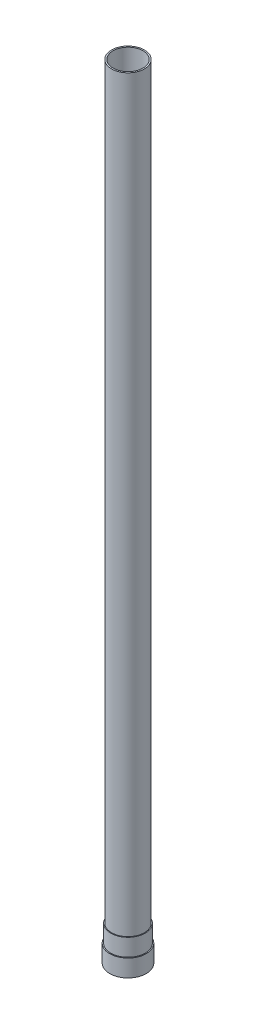
from build123d import *

# Parameters (mm, degrees)
SKETCH1_R           = 15
SKETCH1_R_2         = 13.462
BOSS_EXTRUDE1_DEPTH = 15
SKETCH4_R           = 14.2875
SKETCH4_R_2         = 13.0429
BOSS_EXTRUDE5_DEPTH = 650
BOSS_EXTRUDE6_START = -15
SKETCH1_4_R         = 15.875
SKETCH1_4_R_2       = 13.462
BOSS_EXTRUDE6_DEPTH = 15


with BuildPart() as part:
    # Sketch1 → Boss-Extrude1 (new body)
    with BuildSketch(Plane(origin=(0, 0, 0), x_dir=(1, 0, 0), z_dir=(0, 1, 0))):
        Circle(SKETCH1_R)
        Circle(SKETCH1_R_2, mode=Mode.SUBTRACT)
    extrude(amount=BOSS_EXTRUDE1_DEPTH)

    # Sketch4 → Boss-Extrude5 (add)
    with BuildSketch(Plane(origin=(0, 15, 0), x_dir=(1, 0, 0), z_dir=(0, 1, 0))):
        Circle(SKETCH4_R)
        Circle(SKETCH4_R_2, mode=Mode.SUBTRACT)
    extrude(amount=BOSS_EXTRUDE5_DEPTH)

    # Sketch1<4> → Boss-Extrude6 (add)
    with BuildSketch(Plane(origin=(0, 0, 0), x_dir=(1, 0, 0), z_dir=(0, 1, 0)).offset(BOSS_EXTRUDE6_START)):
        Circle(SKETCH1_4_R)
        Circle(SKETCH1_4_R_2, mode=Mode.SUBTRACT)
    extrude(amount=BOSS_EXTRUDE6_DEPTH)


solid = part.part
